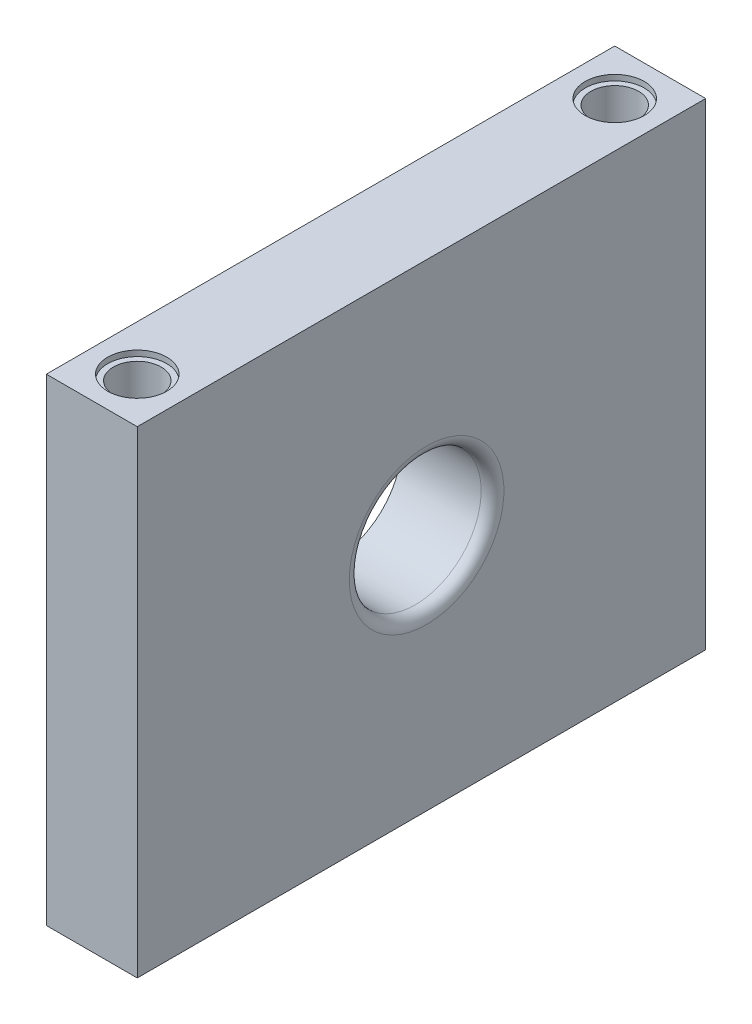
from build123d import *

# Parameters (mm, degrees)
SKETCH1_W           = 25
SKETCH1_H           = 50
SKETCH1_R           = 3.4
BOSS_EXTRUDE1_DEPTH = 3
SKETCH2_W           = 50
SKETCH2_H           = 3
BOSS_EXTRUDE2_DEPTH = 8
SKETCH3_W           = 8
SKETCH3_H           = 50
BOSS_EXTRUDE3_DEPTH = 42
SKETCH4_R           = 2.65
CUT_EXTRUDE1_DEPTH  = 0.5
SKETCH5_R           = 5.802370205
CUT_EXTRUDE2_DEPTH  = 9
FILLET2_R           = 1
SKETCH6_R           = 12.6
BOSS_EXTRUDE4_DEPTH = 2
FILLET4_R           = 1
SKETCH8_R           = 1.589780168
SKETCH8_R_2         = 1.777428262
CUT_EXTRUDE3_DEPTH  = 10
SKETCH9_W           = 49.021678163
SKETCH9_H           = 20.976854622
CUT_EXTRUDE4_DEPTH  = 68.79439129
SKETCH11_R          = 2.1
CUT_EXTRUDE5_DEPTH  = 59.480168703
SKETCH14_R          = 2.6
CUT_EXTRUDE6_DEPTH  = 0.5


with BuildPart() as part:
    # Sketch1 → Boss-Extrude1 (new body)
    with BuildSketch(Plane(origin=(0, 0, 0), x_dir=(1, 0, 0), z_dir=(0, 1, 0))):
        with Locations((2.276951673, 11.384758364)):
            Rectangle(SKETCH1_W, SKETCH1_H)
        with Locations(Location((1.276951673, 11.384758364, 0), (0, 0, 270))):
            Circle(SKETCH1_R, mode=Mode.SUBTRACT)
    extrude(amount=BOSS_EXTRUDE1_DEPTH)

    # Sketch2 → Boss-Extrude2 (add)
    with BuildSketch(Plane.ZY.offset(10.223048327)):
        with Locations((-11.384758364, 1.5)):
            Rectangle(SKETCH2_W, SKETCH2_H)
    extrude(amount=BOSS_EXTRUDE2_DEPTH)

    # Sketch3 → Boss-Extrude3 (add)
    with BuildSketch(Plane.XZ):
        with Locations((-14.223048327, -11.384758364)):
            Rectangle(SKETCH3_W, SKETCH3_H)
    extrude(amount=BOSS_EXTRUDE3_DEPTH)

    # Sketch4 → Cut-Extrude1 (cut)
    with BuildSketch(Plane(origin=(0, 3, 0), x_dir=(1, 0, 0), z_dir=(0, 1, 0))):
        with Locations(Location((-14.223048327, 32.384758364, 0), (0, 0, 270))):
            Circle(SKETCH4_R)
        with Locations(Location((-14.223048327, -9.615241636, 0), (0, 0, 270))):
            Circle(SKETCH4_R)
    cut_extrude1 = extrude(amount=-CUT_EXTRUDE1_DEPTH, mode=Mode.SUBTRACT)

    # Mirror1: Cut-Extrude1 across plane
    add(cut_extrude1.mirror(Plane.ZX.offset(-19.5)), mode=Mode.SUBTRACT)

    # Sketch5 → Cut-Extrude2 (cut)
    with BuildSketch(Plane.ZY.offset(18.223048327)):
        with Locations((-11.836279124, -21)):
            Circle(SKETCH5_R)
    extrude(amount=-CUT_EXTRUDE2_DEPTH, mode=Mode.SUBTRACT)

    # Fillet2
    fillet2_edges = [part.edges().sort_by_distance(p)[0] for p in [
        (-10.223048327, -21, -17.638649329),
    ]]
    fillet(fillet2_edges, radius=FILLET2_R)

    # Mirror2: Cut-Extrude1 across plane
    add(cut_extrude1.mirror(Plane.ZY.offset(1.723048327)), mode=Mode.SUBTRACT)

    # Sketch6 → Boss-Extrude4 (add)
    with BuildSketch(Plane(origin=(0, 3, 0), x_dir=(1, 0, 0), z_dir=(0, 1, 0))):
        with BuildLine():
            Line((14.776951673, 5.825082115), (14.776951673, 16.944434614))
            ThreePointArc((14.776951673, 16.944434614), (-13.323048327, 11.384758364), (14.776951673, 5.825082115))
        make_face()
        with Locations(Location((1.276951673, 11.384758364, 0), (0, 0, 270))):
            Circle(SKETCH6_R, mode=Mode.SUBTRACT)
    extrude(amount=BOSS_EXTRUDE4_DEPTH)

    # Fillet4
    # the kernel refuses this fillet: 1 mm, written as the material it takes off along each edge
    with BuildSketch(Plane(origin=(14.776951673, 5, -3.325082115), x_dir=(0, -1, 0), z_dir=(0, 0, -1))) as fillet4_piece_1:
        with BuildLine():
            CenterArc((FILLET4_R, FILLET4_R), FILLET4_R, 180, 90)
            Line((0, FILLET4_R), (0, 0))
            Line((0, 0), (FILLET4_R, 0))
        make_face()
    extrude(amount=16.119352499, mode=Mode.SUBTRACT)

    # Sketch8 → Cut-Extrude3 (cut)
    with BuildSketch(Plane(origin=(0, 3, 0), x_dir=(1, 0, 0), z_dir=(0, 1, 0))):
        with Locations(Location((1.276951673, 19.884758364, 0), (0, 0, 270))):
            Circle(SKETCH8_R)
        with Locations(Location((1.276951673, 2.884758364, 0), (0, 0, 270))):
            Circle(SKETCH8_R_2)
    extrude(amount=-CUT_EXTRUDE3_DEPTH, mode=Mode.SUBTRACT)

    # Sketch9 → Cut-Extrude4 (cut, through all)
    with BuildSketch(Plane.XY.offset(13.615241636)):
        with Locations((-9.733887409, 10.488427311)):
            Rectangle(SKETCH9_W, SKETCH9_H)
    extrude(amount=-CUT_EXTRUDE4_DEPTH, mode=Mode.SUBTRACT)

    # Sketch11 → Cut-Extrude5 (cut, through all)
    with BuildSketch(Plane(origin=(0, 0, 0), x_dir=(1, 0, 0), z_dir=(0, 1, 0))):
        with Locations(Location((-14.223048327, 32.384758364, 0), (0, 0, 270))):
            Circle(SKETCH11_R)
    cut_extrude5 = extrude(amount=-CUT_EXTRUDE5_DEPTH, mode=Mode.SUBTRACT)

    # Mirror3: Cut-Extrude5 across plane
    add(cut_extrude5.mirror(Plane.XY.offset(-11.384758364)), mode=Mode.SUBTRACT)

    # Sketch14 → Cut-Extrude6 (cut)
    with BuildSketch(Plane(origin=(0, 0, 0), x_dir=(1, 0, 0), z_dir=(0, 1, 0))):
        with Locations(Location((-14.223048327, -9.615241636, 0), (0, 0, 270))):
            Circle(SKETCH14_R)
    cut_extrude6 = extrude(amount=-CUT_EXTRUDE6_DEPTH, mode=Mode.SUBTRACT)

    # Mirror4: Cut-Extrude6 across plane
    add(cut_extrude6.mirror(Plane.XY.offset(-11.384758364)), mode=Mode.SUBTRACT)


solid = part.part
